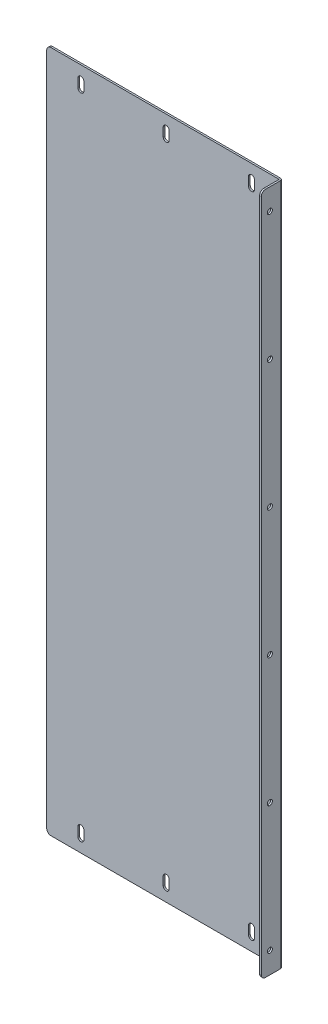
from build123d import *

# Parameters (mm, degrees)
SKETCH_1_W                       = 550
SKETCH_1_H                       = 800
SM_BASE_FLANGE_1_DEPTH           = 2
SKETCH_6_W                       = 40
SKETCH_6_H                       = 130
CUT_EXTRUDE_1_DEPTH              = 10
FILLET_1_R                       = 5
SKETCH_7_W                       = 1
SKETCH_7_H                       = 845.505579408
CUT_EXTRUDE_2_DEPTH              = 10
SKETCH_8_W                       = 313.779033263
SKETCH_8_H                       = 811.185879887
CUT_EXTRUDE_3_DEPTH              = 10
SM_EDGE_FLANGE_1_STRIP_W         = 9.4732
SM_EDGE_FLANGE_1_STRIP_H         = 2
SM_EDGE_FLANGE_1_STRIP_CUT_DEPTH = 800
SM_EDGE_FLANGE_1_DEPTH           = 800
FILLET_2_R                       = 5
HOLE_WIZARD_7_0_7_1_D            = 7
CUT_EXTRUDE_4_DEPTH              = 10
HOLE_WIZARD_6_0_6_1_D            = 6
PATTERN_LINEAR_1_COUNT           = 6
PATTERN_LINEAR_1_PITCH           = 150


# Sheet-metal steps are written as plain solids
with BuildPart() as part:
    # Sketch 1 → 基体-法兰1 (new body)
    with BuildSketch(Plane.XY):
        Rectangle(SKETCH_1_W, SKETCH_1_H)
    extrude(amount=-SM_BASE_FLANGE_1_DEPTH)

    # 草图6 → 切除-拉伸1 (cut)
    with BuildSketch(Plane.XY):
        with Locations((255, 335)):
            Rectangle(SKETCH_6_W, SKETCH_6_H)
        with Locations((255, -335)):
            Rectangle(SKETCH_6_W, SKETCH_6_H)
    extrude(amount=-CUT_EXTRUDE_1_DEPTH, mode=Mode.SUBTRACT)

    # 圆角1
    fillet_1_edges = [part.edges().sort_by_distance(p)[0] for p in [
        (275, 270, -1),
        (235, 270, -1),
        (235, 400, -1),
        (275, -270, -1),
        (235, -400, -1),
        (235, -270, -1),
        (-275, 400, -1),
        (-275, -400, -1),
    ]]
    fillet(fillet_1_edges, radius=FILLET_1_R)

    # 草图7 → 切除-拉伸2 (cut)
    with BuildSketch(Plane.XY):
        Rectangle(SKETCH_7_W, SKETCH_7_H)
    extrude(amount=-CUT_EXTRUDE_2_DEPTH, mode=Mode.SUBTRACT)


with BuildPart() as cut_extrude_2_piece_1:
    # of the separate pieces the step leaves, piece 1, a body of its own (cut_extrude_2_pieces)
    add(part.part.solids().sort_by_distance((-0.5, -400, 0))[0])

    # 边线-法兰1 strip (across the edge) → 边线-法兰1 strip cut (cut)
    with BuildSketch(Plane(origin=(-0.5, -400, 0), x_dir=(-1, 0, 0), z_dir=(0, 1, 0))):
        with Locations((-2, -1)):
            Rectangle(SM_EDGE_FLANGE_1_STRIP_W, SM_EDGE_FLANGE_1_STRIP_H)
    extrude(amount=SM_EDGE_FLANGE_1_STRIP_CUT_DEPTH, mode=Mode.SUBTRACT)

    # 边线-法兰1 section (across the edge) → 边线-法兰1 (add)
    with BuildSketch(Plane(origin=(-0.5, -400, 0), x_dir=(-1, 0, 0), z_dir=(0, 1, 0))):
        with BuildLine():
            Line((0, 0.7366), (0, 23))
            Line((0, 23), (2, 23))
            Line((2, 23), (2, 0.7366))
            ThreePointArc((2, 0.7366), (2.215745145, 0.215745145), (2.7366, 0))
            Line((2.7366, 0), (2.7366, -2))
            ThreePointArc((2.7366, -2), (0.801531583, -1.198468417), (0, 0.7366))
        make_face()
    extrude(amount=SM_EDGE_FLANGE_1_DEPTH)

    # 圆角2
    fillet_2_edges = [cut_extrude_2_piece_1.edges().sort_by_distance(p)[0] for p in [
        (-1.5, -400, 23),
        (-1.5, 400, 23),
    ]]
    fillet(fillet_2_edges, radius=FILLET_2_R)

    # Ø7.0 (7) 直径孔1 (through all)
    with Locations(Plane.XY):
        with Locations((-235, 380), (-135, 380), (-35, 380), (-35, -380), (-135, -380), (-235, -380)):
            Hole(HOLE_WIZARD_7_0_7_1_D / 2)

    # 草图15 → 切除-拉伸4 (cut)
    with BuildSketch(Plane.XY):
        with BuildLine():
            Line((-238.5, 375), (-238.5, 385))
            ThreePointArc((-238.5, 385), (-235, 388.5), (-231.5, 385))
            Line((-231.5, 385), (-231.5, 375))
            ThreePointArc((-231.5, 375), (-235, 371.5), (-238.5, 375))
        make_face()
        with BuildLine():
            Line((-138.5, 375), (-138.5, 385))
            ThreePointArc((-138.5, 385), (-135, 388.5), (-131.5, 385))
            Line((-131.5, 385), (-131.5, 375))
            ThreePointArc((-131.5, 375), (-135, 371.5), (-138.5, 375))
        make_face()
        with BuildLine():
            Line((-38.5, 375), (-38.5, 385))
            ThreePointArc((-38.5, 385), (-35, 388.5), (-31.5, 385))
            Line((-31.5, 385), (-31.5, 375))
            ThreePointArc((-31.5, 375), (-35, 371.5), (-38.5, 375))
        make_face()
        with BuildLine():
            Line((-238.5, -385), (-238.5, -375))
            ThreePointArc((-238.5, -375), (-235, -371.5), (-231.5, -375))
            Line((-231.5, -375), (-231.5, -385))
            ThreePointArc((-231.5, -385), (-235, -388.5), (-238.5, -385))
        make_face()
        with BuildLine():
            Line((-138.5, -385), (-138.5, -375))
            ThreePointArc((-138.5, -375), (-135, -371.5), (-131.5, -375))
            Line((-131.5, -375), (-131.5, -385))
            ThreePointArc((-131.5, -385), (-135, -388.5), (-138.5, -385))
        make_face()
        with BuildLine():
            Line((-38.5, -385), (-38.5, -375))
            ThreePointArc((-38.5, -375), (-35, -371.5), (-31.5, -375))
            Line((-31.5, -375), (-31.5, -385))
            ThreePointArc((-31.5, -385), (-35, -388.5), (-38.5, -385))
        make_face()
    extrude(amount=-CUT_EXTRUDE_4_DEPTH, mode=Mode.SUBTRACT)

    # Ø6.0 (6) 直径孔1 (through all)
    with Locations(Plane.ZY.offset(2.5)):
        with Locations((13, 375)):
            hole_wizard_6_0_6_1 = Hole(HOLE_WIZARD_6_0_6_1_D / 2)

    # 阵列(线性)1: Ø6.0 (6) 直径孔1 ×6
    with Locations(*[(0, -i * PATTERN_LINEAR_1_PITCH, 0) for i in range(1, PATTERN_LINEAR_1_COUNT)]):
        add(hole_wizard_6_0_6_1, mode=Mode.SUBTRACT)


with BuildPart() as cut_extrude_2_piece_2:
    # of the separate pieces the step leaves, piece 2, a body of its own (cut_extrude_2_pieces)
    add(part.part.solids().sort_by_distance((230, -400, 0))[0])

    # 草图8 → 切除-拉伸3 (cut)
    with BuildSketch(Plane.XY):
        with Locations((157.389516632, -5.592939943)):
            Rectangle(SKETCH_8_W, SKETCH_8_H)
    extrude(amount=-CUT_EXTRUDE_3_DEPTH, mode=Mode.SUBTRACT)


solid = cut_extrude_2_piece_1.part
